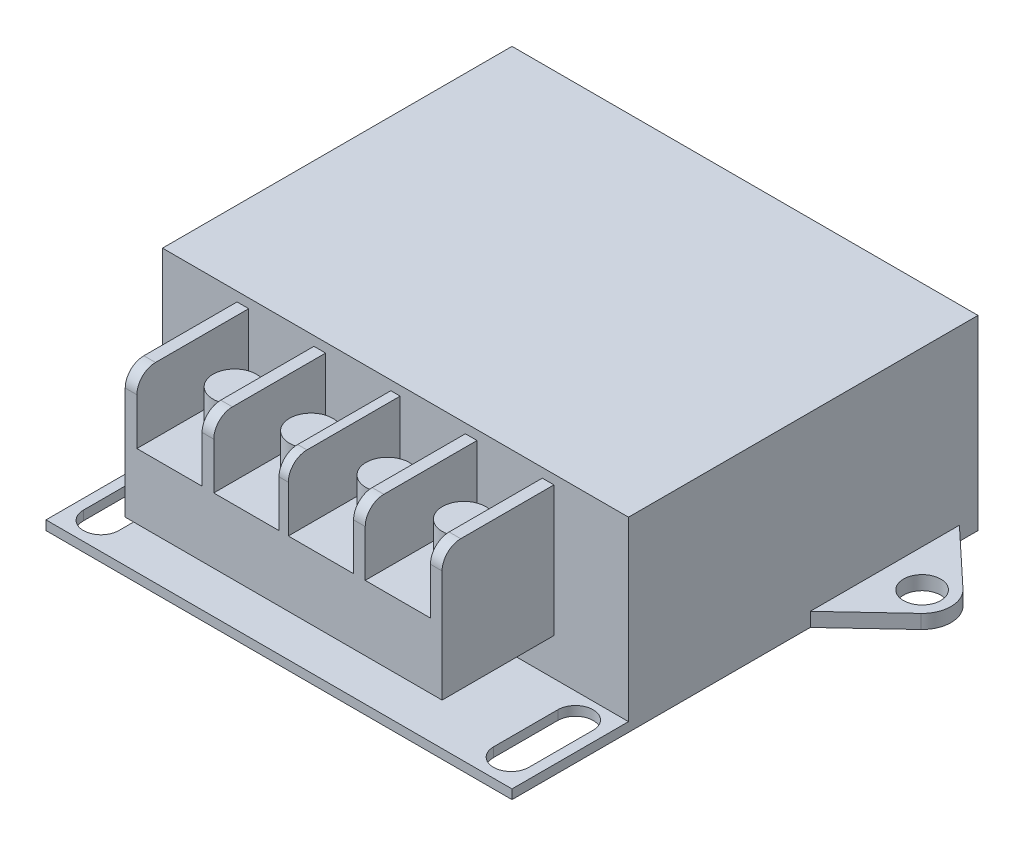
from build123d import *

# Parameters (mm, degrees)
SKETCH1_W           = 50
SKETCH1_H           = 50
BOSS_EXTRUDE1_DEPTH = 1
SKETCH2_W           = 50
SKETCH2_H           = 37.5
BOSS_EXTRUDE2_DEPTH = 19
SKETCH3_W           = 34
SKETCH3_H           = 14
BOSS_EXTRUDE3_DEPTH = 12
SKETCH4_R           = 2
BOSS_EXTRUDE4_DEPTH = 1.5
SKETCH5_W           = 7
SKETCH5_H           = 12
CUT_EXTRUDE1_DEPTH  = 7
FILLET1_R           = 2
SKETCH6_R           = 2.32139267
BOSS_EXTRUDE5_DEPTH = 4
LPATTERN1_COUNT     = 4
LPATTERN1_PITCH     = 8.2
CUT_EXTRUDE2_DEPTH  = 79.241453861


with BuildPart() as part:
    # Sketch1 → Boss-Extrude1 (new body)
    with BuildSketch(Plane(origin=(0, 0, 0), x_dir=(1, 0, 0), z_dir=(0, 1, 0))):
        with Locations((25, 25)):
            Rectangle(SKETCH1_W, SKETCH1_H)
    extrude(amount=BOSS_EXTRUDE1_DEPTH)

    # Sketch2 → Boss-Extrude2 (add)
    with BuildSketch(Plane(origin=(0, 1, 0), x_dir=(1, 0, 0), z_dir=(0, 1, 0))):
        with Locations((25, 31.25)):
            Rectangle(SKETCH2_W, SKETCH2_H)
    extrude(amount=BOSS_EXTRUDE2_DEPTH)

    # Sketch3 → Boss-Extrude3 (add)
    with BuildSketch(Plane.XY.offset(-12.5)):
        with Locations((25, 12)):
            Rectangle(SKETCH3_W, SKETCH3_H)
    extrude(amount=BOSS_EXTRUDE3_DEPTH)

    # Sketch4 → Boss-Extrude4 (add)
    with BuildSketch(Plane.XZ):
        with BuildLine():
            Line((0, -32.003753373), (-6.121503896, -37.739612135))
            ThreePointArc((-6.121503896, -37.739612135), (-7.102759148, -40.003753373), (-6.121503896, -42.267894612))
            Line((-6.121503896, -42.267894612), (0, -48.003753373))
            Line((0, -48.003753373), (0, -32.003753373))
        make_face()
        with Locations((-4, -40.003753373)):
            Circle(SKETCH4_R, mode=Mode.SUBTRACT)
    boss_extrude4 = extrude(amount=-BOSS_EXTRUDE4_DEPTH)

    # Mirror1: Boss-Extrude4 across plane
    add(boss_extrude4.mirror(Plane.ZY.offset(-25)))

    # Sketch5 → Cut-Extrude1 (cut)
    with BuildSketch(Plane(origin=(0, 19, 0), x_dir=(1, 0, 0), z_dir=(0, 1, 0))):
        with Locations((12.75, 6.5)):
            Rectangle(SKETCH5_W, SKETCH5_H)
        with Locations((21, 6.5)):
            Rectangle(SKETCH5_W, SKETCH5_H)
        with Locations((29, 6.5)):
            Rectangle(SKETCH5_W, SKETCH5_H)
        with Locations((37.25, 6.5)):
            Rectangle(SKETCH5_W, SKETCH5_H)
    extrude(amount=-CUT_EXTRUDE1_DEPTH, mode=Mode.SUBTRACT)

    # Fillet1
    fillet1_edges = [part.edges().sort_by_distance(p)[0] for p in [
        (41.375, 19, -0.5),
        (33.125, 19, -0.5),
        (25, 19, -0.5),
        (16.875, 19, -0.5),
        (8.625, 19, -0.5),
    ]]
    fillet(fillet1_edges, radius=FILLET1_R)

    # Sketch6 → Boss-Extrude5 (add)
    with BuildSketch(Plane(origin=(0, 12, 0), x_dir=(1, 0, 0), z_dir=(0, 1, 0))):
        with Locations((12.75, 7.5)):
            Circle(SKETCH6_R)
    boss_extrude5 = extrude(amount=BOSS_EXTRUDE5_DEPTH)

    # LPattern1: Boss-Extrude5 ×4
    with Locations(*[(i * LPATTERN1_PITCH, 0, 0) for i in range(1, LPATTERN1_COUNT)]):
        add(boss_extrude5)

    # Sketch7 → Cut-Extrude2 (cut, through all)
    with BuildSketch(Plane(origin=(0, 1, 0), x_dir=(1, 0, 0), z_dir=(0, 1, 0))):
        with BuildLine():
            Line((4.9, 9.811459389), (4.9, 2.913606885))
            ThreePointArc((4.9, 2.913606885), (3, 1.013606885), (1.1, 2.913606885))
            Line((1.1, 2.913606885), (1.1, 9.811459389))
            ThreePointArc((1.1, 9.811459389), (3, 11.711459389), (4.9, 9.811459389))
        make_face()
        with BuildLine():
            Line((48.9, 9.811459389), (48.9, 2.913606885))
            ThreePointArc((48.9, 2.913606885), (47, 1.013606885), (45.1, 2.913606885))
            Line((45.1, 2.913606885), (45.1, 9.811459389))
            ThreePointArc((45.1, 9.811459389), (47, 11.711459389), (48.9, 9.811459389))
        make_face()
    extrude(amount=-CUT_EXTRUDE2_DEPTH, mode=Mode.SUBTRACT)


solid = part.part
